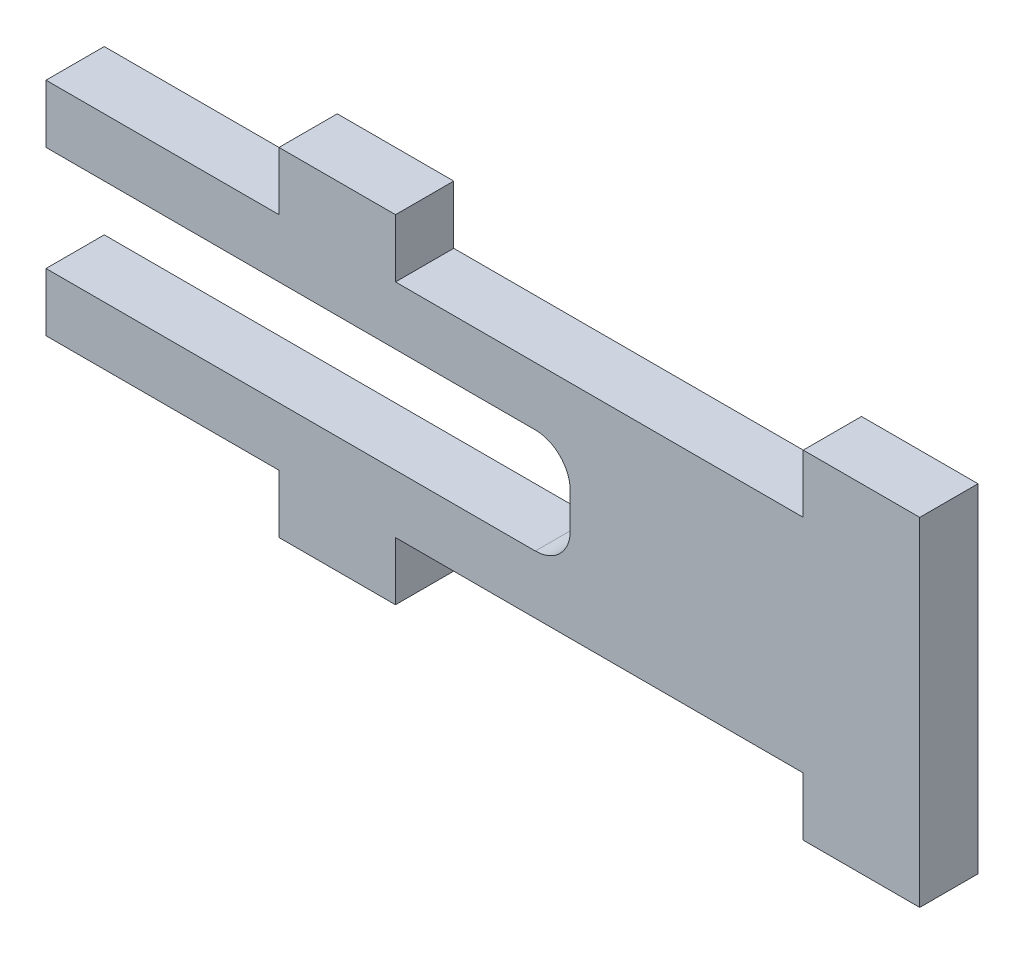
from build123d import *

# Parameters (mm, degrees)
BOSS_EXTRUDE1_DEPTH = 5


with BuildPart() as part:
    # Sketch2 → Boss-Extrude1 (new body)
    with BuildSketch(Plane.XY):
        with BuildLine():
            Line((0, -14.5), (0, 14.5))
            Line((0, 14.5), (-10, 14.5))
            Line((-10, 14.5), (-10, 9.5))
            Line((-10, 9.5), (-45, 9.5))
            Line((-45, 9.5), (-45, 14.5))
            Line((-45, 14.5), (-55, 14.5))
            Line((-55, 14.5), (-55, 9.5))
            Line((-55, 9.5), (-75, 9.5))
            Line((-75, 9.5), (-75, 4.5))
            Line((-75, 4.5), (-33, 4.5))
            ThreePointArc((-33, 4.5), (-30.878679656, 3.621320344), (-30, 1.5))
            Line((-30, 1.5), (-30, 0))
            Line((-30, 0), (-30, -1.5))
            ThreePointArc((-30, -1.5), (-30.878679656, -3.621320344), (-33, -4.5))
            Line((-33, -4.5), (-75, -4.5))
            Line((-75, -4.5), (-75, -9.5))
            Line((-75, -9.5), (-55, -9.5))
            Line((-55, -9.5), (-55, -14.5))
            Line((-55, -14.5), (-45, -14.5))
            Line((-45, -14.5), (-45, -9.5))
            Line((-45, -9.5), (-10, -9.5))
            Line((-10, -9.5), (-10, -14.5))
            Line((-10, -14.5), (0, -14.5))
        make_face()
    extrude(amount=BOSS_EXTRUDE1_DEPTH)


solid = part.part
